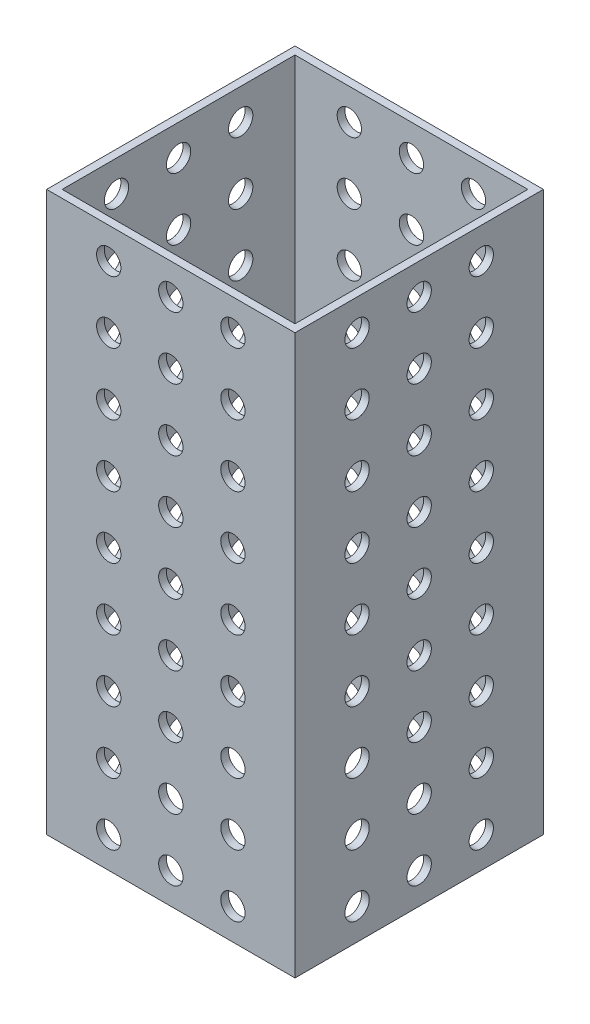
from build123d import *

# Parameters (mm, degrees)
SKETCH1_W           = 50.8
SKETCH1_H           = 50.8
SKETCH1_W_2         = 47.625
SKETCH1_H_2         = 47.625
BOSS_EXTRUDE1_DEPTH = 685.8
SKETCH2_R           = 2.4892
CUT_EXTRUDE1_DEPTH  = 689.147832955
SKETCH4_R           = 2.4892
CUT_EXTRUDE2_DEPTH  = 689.147832955
SKETCH5_W           = 50.8
SKETCH5_H           = 571.5
CUT_EXTRUDE3_DEPTH  = 689.147832955


with BuildPart() as part:
    # Sketch1 → Boss-Extrude1 (new body)
    with BuildSketch(Plane(origin=(0, 0, 0), x_dir=(1, 0, 0), z_dir=(0, 1, 0))):
        Rectangle(SKETCH1_W, SKETCH1_H)
        Rectangle(SKETCH1_W_2, SKETCH1_H_2, mode=Mode.SUBTRACT)
    extrude(amount=BOSS_EXTRUDE1_DEPTH)

    # Sketch2 → Cut-Extrude1 (cut, through all)
    with BuildSketch(Plane.XY.offset(25.4)):
        with Locations((-12.7, 679.45)):
            Circle(SKETCH2_R)
        with Locations((-12.7, 666.75)):
            Circle(SKETCH2_R)
        with Locations((-12.7, 654.05)):
            Circle(SKETCH2_R)
        with Locations((-12.7, 641.35)):
            Circle(SKETCH2_R)
        with Locations((-12.7, 628.65)):
            Circle(SKETCH2_R)
        with Locations((-12.7, 615.95)):
            Circle(SKETCH2_R)
        with Locations((-12.7, 603.25)):
            Circle(SKETCH2_R)
        with Locations((-12.7, 590.55)):
            Circle(SKETCH2_R)
        with Locations((-12.7, 577.85)):
            Circle(SKETCH2_R)
        with Locations((-12.7, 565.15)):
            Circle(SKETCH2_R)
        with Locations((-12.7, 552.45)):
            Circle(SKETCH2_R)
        with Locations((-12.7, 539.75)):
            Circle(SKETCH2_R)
        with Locations((-12.7, 527.05)):
            Circle(SKETCH2_R)
        with Locations((-12.7, 514.35)):
            Circle(SKETCH2_R)
        with Locations((-12.7, 501.65)):
            Circle(SKETCH2_R)
        with Locations((-12.7, 488.95)):
            Circle(SKETCH2_R)
        with Locations((-12.7, 476.25)):
            Circle(SKETCH2_R)
        with Locations((-12.7, 463.55)):
            Circle(SKETCH2_R)
        with Locations((-12.7, 450.85)):
            Circle(SKETCH2_R)
        with Locations((-12.7, 438.15)):
            Circle(SKETCH2_R)
        with Locations((-12.7, 425.45)):
            Circle(SKETCH2_R)
        with Locations((-12.7, 412.75)):
            Circle(SKETCH2_R)
        with Locations((-12.7, 400.05)):
            Circle(SKETCH2_R)
        with Locations((-12.7, 387.35)):
            Circle(SKETCH2_R)
        with Locations((-12.7, 374.65)):
            Circle(SKETCH2_R)
        with Locations((-12.7, 361.95)):
            Circle(SKETCH2_R)
        with Locations((-12.7, 349.25)):
            Circle(SKETCH2_R)
        with Locations((-12.7, 336.55)):
            Circle(SKETCH2_R)
        with Locations((-12.7, 323.85)):
            Circle(SKETCH2_R)
        with Locations((-12.7, 311.15)):
            Circle(SKETCH2_R)
        with Locations((-12.7, 298.45)):
            Circle(SKETCH2_R)
        with Locations((-12.7, 285.75)):
            Circle(SKETCH2_R)
        with Locations((-12.7, 273.05)):
            Circle(SKETCH2_R)
        with Locations((-12.7, 260.35)):
            Circle(SKETCH2_R)
        with Locations((-12.7, 247.65)):
            Circle(SKETCH2_R)
        with Locations((-12.7, 234.95)):
            Circle(SKETCH2_R)
        with Locations((-12.7, 222.25)):
            Circle(SKETCH2_R)
        with Locations((-12.7, 209.55)):
            Circle(SKETCH2_R)
        with Locations((-12.7, 196.85)):
            Circle(SKETCH2_R)
        with Locations((-12.7, 184.15)):
            Circle(SKETCH2_R)
        with Locations((-12.7, 171.45)):
            Circle(SKETCH2_R)
        with Locations((-12.7, 158.75)):
            Circle(SKETCH2_R)
        with Locations((-12.7, 146.05)):
            Circle(SKETCH2_R)
        with Locations((-12.7, 133.35)):
            Circle(SKETCH2_R)
        with Locations((-12.7, 120.65)):
            Circle(SKETCH2_R)
        with Locations((-12.7, 107.95)):
            Circle(SKETCH2_R)
        with Locations((-12.7, 95.25)):
            Circle(SKETCH2_R)
        with Locations((-12.7, 82.55)):
            Circle(SKETCH2_R)
        with Locations((-12.7, 69.85)):
            Circle(SKETCH2_R)
        with Locations((-12.7, 57.15)):
            Circle(SKETCH2_R)
        with Locations((-12.7, 44.45)):
            Circle(SKETCH2_R)
        with Locations((-12.7, 31.75)):
            Circle(SKETCH2_R)
        with Locations((-12.7, 19.05)):
            Circle(SKETCH2_R)
        with Locations((-12.7, 6.35)):
            Circle(SKETCH2_R)
        with Locations((12.7, 6.35)):
            Circle(SKETCH2_R)
        with Locations((12.7, 19.05)):
            Circle(SKETCH2_R)
        with Locations((12.7, 31.75)):
            Circle(SKETCH2_R)
        with Locations((12.7, 44.45)):
            Circle(SKETCH2_R)
        with Locations((12.7, 57.15)):
            Circle(SKETCH2_R)
        with Locations((12.7, 69.85)):
            Circle(SKETCH2_R)
        with Locations((12.7, 82.55)):
            Circle(SKETCH2_R)
        with Locations((12.7, 95.25)):
            Circle(SKETCH2_R)
        with Locations((12.7, 107.95)):
            Circle(SKETCH2_R)
        with Locations((12.7, 120.65)):
            Circle(SKETCH2_R)
        with Locations((12.7, 133.35)):
            Circle(SKETCH2_R)
        with Locations((12.7, 146.05)):
            Circle(SKETCH2_R)
        with Locations((12.7, 158.75)):
            Circle(SKETCH2_R)
        with Locations((12.7, 171.45)):
            Circle(SKETCH2_R)
        with Locations((12.7, 184.15)):
            Circle(SKETCH2_R)
        with Locations((12.7, 196.85)):
            Circle(SKETCH2_R)
        with Locations((12.7, 209.55)):
            Circle(SKETCH2_R)
        with Locations((12.7, 222.25)):
            Circle(SKETCH2_R)
        with Locations((12.7, 234.95)):
            Circle(SKETCH2_R)
        with Locations((12.7, 247.65)):
            Circle(SKETCH2_R)
        with Locations((12.7, 260.35)):
            Circle(SKETCH2_R)
        with Locations((12.7, 273.05)):
            Circle(SKETCH2_R)
        with Locations((12.7, 285.75)):
            Circle(SKETCH2_R)
        with Locations((12.7, 298.45)):
            Circle(SKETCH2_R)
        with Locations((12.7, 311.15)):
            Circle(SKETCH2_R)
        with Locations((12.7, 323.85)):
            Circle(SKETCH2_R)
        with Locations((12.7, 336.55)):
            Circle(SKETCH2_R)
        with Locations((12.7, 374.65)):
            Circle(SKETCH2_R)
        with Locations((12.7, 361.95)):
            Circle(SKETCH2_R)
        with Locations((12.7, 349.25)):
            Circle(SKETCH2_R)
        with Locations((12.7, 387.35)):
            Circle(SKETCH2_R)
        with Locations((12.7, 400.05)):
            Circle(SKETCH2_R)
        with Locations((12.7, 412.75)):
            Circle(SKETCH2_R)
        with Locations((12.7, 425.45)):
            Circle(SKETCH2_R)
        with Locations((12.7, 438.15)):
            Circle(SKETCH2_R)
        with Locations((12.7, 450.85)):
            Circle(SKETCH2_R)
        with Locations((12.7, 463.55)):
            Circle(SKETCH2_R)
        with Locations((12.7, 476.25)):
            Circle(SKETCH2_R)
        with Locations((12.7, 488.95)):
            Circle(SKETCH2_R)
        with Locations((12.7, 501.65)):
            Circle(SKETCH2_R)
        with Locations((12.7, 514.35)):
            Circle(SKETCH2_R)
        with Locations((12.7, 527.05)):
            Circle(SKETCH2_R)
        with Locations((12.7, 539.75)):
            Circle(SKETCH2_R)
        with Locations((12.7, 552.45)):
            Circle(SKETCH2_R)
        with Locations((12.7, 565.15)):
            Circle(SKETCH2_R)
        with Locations((12.7, 577.85)):
            Circle(SKETCH2_R)
        with Locations((12.7, 590.55)):
            Circle(SKETCH2_R)
        with Locations((12.7, 603.25)):
            Circle(SKETCH2_R)
        with Locations((12.7, 615.95)):
            Circle(SKETCH2_R)
        with Locations((12.7, 628.65)):
            Circle(SKETCH2_R)
        with Locations((12.7, 641.35)):
            Circle(SKETCH2_R)
        with Locations((12.7, 654.05)):
            Circle(SKETCH2_R)
        with Locations((12.7, 666.75)):
            Circle(SKETCH2_R)
        with Locations((12.7, 679.45)):
            Circle(SKETCH2_R)
        with Locations((0, 6.35)):
            Circle(SKETCH2_R)
        with Locations((0, 19.05)):
            Circle(SKETCH2_R)
        with Locations((0, 31.75)):
            Circle(SKETCH2_R)
        with Locations((0, 44.45)):
            Circle(SKETCH2_R)
        with Locations((0, 57.15)):
            Circle(SKETCH2_R)
        with Locations((0, 69.85)):
            Circle(SKETCH2_R)
        with Locations((0, 82.55)):
            Circle(SKETCH2_R)
        with Locations((0, 95.25)):
            Circle(SKETCH2_R)
        with Locations((0, 107.95)):
            Circle(SKETCH2_R)
        with Locations((0, 120.65)):
            Circle(SKETCH2_R)
        with Locations((0, 133.35)):
            Circle(SKETCH2_R)
        with Locations((0, 146.05)):
            Circle(SKETCH2_R)
        with Locations((0, 158.75)):
            Circle(SKETCH2_R)
        with Locations((0, 171.45)):
            Circle(SKETCH2_R)
        with Locations((0, 184.15)):
            Circle(SKETCH2_R)
        with Locations((0, 196.85)):
            Circle(SKETCH2_R)
        with Locations((0, 209.55)):
            Circle(SKETCH2_R)
        with Locations((0, 222.25)):
            Circle(SKETCH2_R)
        with Locations((0, 234.95)):
            Circle(SKETCH2_R)
        with Locations((0, 247.65)):
            Circle(SKETCH2_R)
        with Locations((0, 260.35)):
            Circle(SKETCH2_R)
        with Locations((0, 273.05)):
            Circle(SKETCH2_R)
        with Locations((0, 285.75)):
            Circle(SKETCH2_R)
        with Locations((0, 298.45)):
            Circle(SKETCH2_R)
        with Locations((0, 311.15)):
            Circle(SKETCH2_R)
        with Locations((0, 323.85)):
            Circle(SKETCH2_R)
        with Locations((0, 336.55)):
            Circle(SKETCH2_R)
        with Locations((0, 349.25)):
            Circle(SKETCH2_R)
        with Locations((0, 361.95)):
            Circle(SKETCH2_R)
        with Locations((0, 374.65)):
            Circle(SKETCH2_R)
        with Locations((0, 387.35)):
            Circle(SKETCH2_R)
        with Locations((0, 400.05)):
            Circle(SKETCH2_R)
        with Locations((0, 412.75)):
            Circle(SKETCH2_R)
        with Locations((0, 425.45)):
            Circle(SKETCH2_R)
        with Locations((0, 438.15)):
            Circle(SKETCH2_R)
        with Locations((0, 450.85)):
            Circle(SKETCH2_R)
        with Locations((0, 463.55)):
            Circle(SKETCH2_R)
        with Locations((0, 476.25)):
            Circle(SKETCH2_R)
        with Locations((0, 488.95)):
            Circle(SKETCH2_R)
        with Locations((0, 501.65)):
            Circle(SKETCH2_R)
        with Locations((0, 514.35)):
            Circle(SKETCH2_R)
        with Locations((0, 527.05)):
            Circle(SKETCH2_R)
        with Locations((0, 539.75)):
            Circle(SKETCH2_R)
        with Locations((0, 552.45)):
            Circle(SKETCH2_R)
        with Locations((0, 565.15)):
            Circle(SKETCH2_R)
        with Locations((0, 577.85)):
            Circle(SKETCH2_R)
        with Locations((0, 590.55)):
            Circle(SKETCH2_R)
        with Locations((0, 603.25)):
            Circle(SKETCH2_R)
        with Locations((0, 615.95)):
            Circle(SKETCH2_R)
        with Locations((0, 628.65)):
            Circle(SKETCH2_R)
        with Locations((0, 641.35)):
            Circle(SKETCH2_R)
        with Locations((0, 654.05)):
            Circle(SKETCH2_R)
        with Locations((0, 666.75)):
            Circle(SKETCH2_R)
        with Locations((0, 679.45)):
            Circle(SKETCH2_R)
    extrude(amount=-CUT_EXTRUDE1_DEPTH, mode=Mode.SUBTRACT)

    # Sketch4 → Cut-Extrude2 (cut, through all)
    with BuildSketch(Plane(origin=(25.4, 0, 0), x_dir=(0, 0, -1), z_dir=(1, 0, 0))):
        with Locations((-12.7, 679.45)):
            Circle(SKETCH4_R)
        with Locations((-12.7, 666.75)):
            Circle(SKETCH4_R)
        with Locations((-12.7, 654.05)):
            Circle(SKETCH4_R)
        with Locations((-12.7, 641.35)):
            Circle(SKETCH4_R)
        with Locations((-12.7, 628.65)):
            Circle(SKETCH4_R)
        with Locations((-12.7, 615.95)):
            Circle(SKETCH4_R)
        with Locations((-12.7, 603.25)):
            Circle(SKETCH4_R)
        with Locations((-12.7, 590.55)):
            Circle(SKETCH4_R)
        with Locations((-12.7, 577.85)):
            Circle(SKETCH4_R)
        with Locations((-12.7, 565.15)):
            Circle(SKETCH4_R)
        with Locations((-12.7, 552.45)):
            Circle(SKETCH4_R)
        with Locations((-12.7, 539.75)):
            Circle(SKETCH4_R)
        with Locations((-12.7, 527.05)):
            Circle(SKETCH4_R)
        with Locations((-12.7, 514.35)):
            Circle(SKETCH4_R)
        with Locations((-12.7, 501.65)):
            Circle(SKETCH4_R)
        with Locations((-12.7, 488.95)):
            Circle(SKETCH4_R)
        with Locations((-12.7, 476.25)):
            Circle(SKETCH4_R)
        with Locations((-12.7, 463.55)):
            Circle(SKETCH4_R)
        with Locations((-12.7, 450.85)):
            Circle(SKETCH4_R)
        with Locations((-12.7, 438.15)):
            Circle(SKETCH4_R)
        with Locations((-12.7, 425.45)):
            Circle(SKETCH4_R)
        with Locations((-12.7, 412.75)):
            Circle(SKETCH4_R)
        with Locations((-12.7, 400.05)):
            Circle(SKETCH4_R)
        with Locations((-12.7, 387.35)):
            Circle(SKETCH4_R)
        with Locations((-12.7, 374.65)):
            Circle(SKETCH4_R)
        with Locations((-12.7, 361.95)):
            Circle(SKETCH4_R)
        with Locations((-12.7, 349.25)):
            Circle(SKETCH4_R)
        with Locations((-12.7, 336.55)):
            Circle(SKETCH4_R)
        with Locations((-12.7, 323.85)):
            Circle(SKETCH4_R)
        with Locations((-12.7, 311.15)):
            Circle(SKETCH4_R)
        with Locations((-12.7, 298.45)):
            Circle(SKETCH4_R)
        with Locations((-12.7, 285.75)):
            Circle(SKETCH4_R)
        with Locations((-12.7, 273.05)):
            Circle(SKETCH4_R)
        with Locations((-12.7, 260.35)):
            Circle(SKETCH4_R)
        with Locations((-12.7, 247.65)):
            Circle(SKETCH4_R)
        with Locations((-12.7, 234.95)):
            Circle(SKETCH4_R)
        with Locations((-12.7, 222.25)):
            Circle(SKETCH4_R)
        with Locations((-12.7, 209.55)):
            Circle(SKETCH4_R)
        with Locations((-12.7, 196.85)):
            Circle(SKETCH4_R)
        with Locations((-12.7, 184.15)):
            Circle(SKETCH4_R)
        with Locations((-12.7, 171.45)):
            Circle(SKETCH4_R)
        with Locations((-12.7, 158.75)):
            Circle(SKETCH4_R)
        with Locations((-12.7, 146.05)):
            Circle(SKETCH4_R)
        with Locations((-12.7, 133.35)):
            Circle(SKETCH4_R)
        with Locations((-12.7, 120.65)):
            Circle(SKETCH4_R)
        with Locations((-12.7, 107.95)):
            Circle(SKETCH4_R)
        with Locations((-12.7, 95.25)):
            Circle(SKETCH4_R)
        with Locations((-12.7, 82.55)):
            Circle(SKETCH4_R)
        with Locations((-12.7, 69.85)):
            Circle(SKETCH4_R)
        with Locations((-12.7, 57.15)):
            Circle(SKETCH4_R)
        with Locations((-12.7, 44.45)):
            Circle(SKETCH4_R)
        with Locations((-12.7, 31.75)):
            Circle(SKETCH4_R)
        with Locations((-12.7, 19.05)):
            Circle(SKETCH4_R)
        with Locations((-12.7, 6.35)):
            Circle(SKETCH4_R)
        with Locations((12.7, 273.05)):
            Circle(SKETCH4_R)
        with Locations((12.7, 285.75)):
            Circle(SKETCH4_R)
        with Locations((12.7, 298.45)):
            Circle(SKETCH4_R)
        with Locations((12.7, 311.15)):
            Circle(SKETCH4_R)
        with Locations((12.7, 323.85)):
            Circle(SKETCH4_R)
        with Locations((12.7, 336.55)):
            Circle(SKETCH4_R)
        with Locations((12.7, 349.25)):
            Circle(SKETCH4_R)
        with Locations((12.7, 361.95)):
            Circle(SKETCH4_R)
        with Locations((12.7, 374.65)):
            Circle(SKETCH4_R)
        with Locations((12.7, 387.35)):
            Circle(SKETCH4_R)
        with Locations((12.7, 400.05)):
            Circle(SKETCH4_R)
        with Locations((12.7, 412.75)):
            Circle(SKETCH4_R)
        with Locations((12.7, 425.45)):
            Circle(SKETCH4_R)
        with Locations((12.7, 438.15)):
            Circle(SKETCH4_R)
        with Locations((12.7, 450.85)):
            Circle(SKETCH4_R)
        with Locations((12.7, 463.55)):
            Circle(SKETCH4_R)
        with Locations((12.7, 476.25)):
            Circle(SKETCH4_R)
        with Locations((12.7, 488.95)):
            Circle(SKETCH4_R)
        with Locations((12.7, 501.65)):
            Circle(SKETCH4_R)
        with Locations((12.7, 514.35)):
            Circle(SKETCH4_R)
        with Locations((12.7, 527.05)):
            Circle(SKETCH4_R)
        with Locations((12.7, 539.75)):
            Circle(SKETCH4_R)
        with Locations((12.7, 552.45)):
            Circle(SKETCH4_R)
        with Locations((12.7, 565.15)):
            Circle(SKETCH4_R)
        with Locations((12.7, 577.85)):
            Circle(SKETCH4_R)
        with Locations((12.7, 590.55)):
            Circle(SKETCH4_R)
        with Locations((12.7, 603.25)):
            Circle(SKETCH4_R)
        with Locations((12.7, 615.95)):
            Circle(SKETCH4_R)
        with Locations((12.7, 628.65)):
            Circle(SKETCH4_R)
        with Locations((12.7, 641.35)):
            Circle(SKETCH4_R)
        with Locations((12.7, 654.05)):
            Circle(SKETCH4_R)
        with Locations((12.7, 666.75)):
            Circle(SKETCH4_R)
        with Locations((12.7, 19.05)):
            Circle(SKETCH4_R)
        with Locations((12.7, 31.75)):
            Circle(SKETCH4_R)
        with Locations((12.7, 44.45)):
            Circle(SKETCH4_R)
        with Locations((12.7, 57.15)):
            Circle(SKETCH4_R)
        with Locations((12.7, 69.85)):
            Circle(SKETCH4_R)
        with Locations((12.7, 82.55)):
            Circle(SKETCH4_R)
        with Locations((12.7, 95.25)):
            Circle(SKETCH4_R)
        with Locations((12.7, 107.95)):
            Circle(SKETCH4_R)
        with Locations((12.7, 120.65)):
            Circle(SKETCH4_R)
        with Locations((12.7, 133.35)):
            Circle(SKETCH4_R)
        with Locations((12.7, 146.05)):
            Circle(SKETCH4_R)
        with Locations((12.7, 158.75)):
            Circle(SKETCH4_R)
        with Locations((12.7, 171.45)):
            Circle(SKETCH4_R)
        with Locations((12.7, 184.15)):
            Circle(SKETCH4_R)
        with Locations((12.7, 196.85)):
            Circle(SKETCH4_R)
        with Locations((12.7, 209.55)):
            Circle(SKETCH4_R)
        with Locations((12.7, 222.25)):
            Circle(SKETCH4_R)
        with Locations((12.7, 234.95)):
            Circle(SKETCH4_R)
        with Locations((12.7, 247.65)):
            Circle(SKETCH4_R)
        with Locations((12.7, 260.35)):
            Circle(SKETCH4_R)
        with Locations((12.7, 6.35)):
            Circle(SKETCH4_R)
        with Locations((12.7, 679.45)):
            Circle(SKETCH4_R)
        with Locations((0, 6.35)):
            Circle(SKETCH4_R)
        with Locations((0, 19.05)):
            Circle(SKETCH4_R)
        with Locations((0, 31.75)):
            Circle(SKETCH4_R)
        with Locations((0, 44.45)):
            Circle(SKETCH4_R)
        with Locations((0, 57.15)):
            Circle(SKETCH4_R)
        with Locations((0, 69.85)):
            Circle(SKETCH4_R)
        with Locations((0, 82.55)):
            Circle(SKETCH4_R)
        with Locations((0, 95.25)):
            Circle(SKETCH4_R)
        with Locations((0, 107.95)):
            Circle(SKETCH4_R)
        with Locations((0, 120.65)):
            Circle(SKETCH4_R)
        with Locations((0, 133.35)):
            Circle(SKETCH4_R)
        with Locations((0, 146.05)):
            Circle(SKETCH4_R)
        with Locations((0, 158.75)):
            Circle(SKETCH4_R)
        with Locations((0, 171.45)):
            Circle(SKETCH4_R)
        with Locations((0, 184.15)):
            Circle(SKETCH4_R)
        with Locations((0, 196.85)):
            Circle(SKETCH4_R)
        with Locations((0, 209.55)):
            Circle(SKETCH4_R)
        with Locations((0, 222.25)):
            Circle(SKETCH4_R)
        with Locations((0, 234.95)):
            Circle(SKETCH4_R)
        with Locations((0, 247.65)):
            Circle(SKETCH4_R)
        with Locations((0, 260.35)):
            Circle(SKETCH4_R)
        with Locations((0, 273.05)):
            Circle(SKETCH4_R)
        with Locations((0, 285.75)):
            Circle(SKETCH4_R)
        with Locations((0, 298.45)):
            Circle(SKETCH4_R)
        with Locations((0, 311.15)):
            Circle(SKETCH4_R)
        with Locations((0, 323.85)):
            Circle(SKETCH4_R)
        with Locations((0, 336.55)):
            Circle(SKETCH4_R)
        with Locations((0, 349.25)):
            Circle(SKETCH4_R)
        with Locations((0, 361.95)):
            Circle(SKETCH4_R)
        with Locations((0, 374.65)):
            Circle(SKETCH4_R)
        with Locations((0, 387.35)):
            Circle(SKETCH4_R)
        with Locations((0, 400.05)):
            Circle(SKETCH4_R)
        with Locations((0, 412.75)):
            Circle(SKETCH4_R)
        with Locations((0, 425.45)):
            Circle(SKETCH4_R)
        with Locations((0, 438.15)):
            Circle(SKETCH4_R)
        with Locations((0, 450.85)):
            Circle(SKETCH4_R)
        with Locations((0, 463.55)):
            Circle(SKETCH4_R)
        with Locations((0, 476.25)):
            Circle(SKETCH4_R)
        with Locations((0, 488.95)):
            Circle(SKETCH4_R)
        with Locations((0, 501.65)):
            Circle(SKETCH4_R)
        with Locations((0, 514.35)):
            Circle(SKETCH4_R)
        with Locations((0, 527.05)):
            Circle(SKETCH4_R)
        with Locations((0, 539.75)):
            Circle(SKETCH4_R)
        with Locations((0, 552.45)):
            Circle(SKETCH4_R)
        with Locations((0, 565.15)):
            Circle(SKETCH4_R)
        with Locations((0, 577.85)):
            Circle(SKETCH4_R)
        with Locations((0, 590.55)):
            Circle(SKETCH4_R)
        with Locations((0, 603.25)):
            Circle(SKETCH4_R)
        with Locations((0, 615.95)):
            Circle(SKETCH4_R)
        with Locations((0, 628.65)):
            Circle(SKETCH4_R)
        with Locations((0, 641.35)):
            Circle(SKETCH4_R)
        with Locations((0, 654.05)):
            Circle(SKETCH4_R)
        with Locations((0, 666.75)):
            Circle(SKETCH4_R)
        with Locations((0, 679.45)):
            Circle(SKETCH4_R)
    extrude(amount=-CUT_EXTRUDE2_DEPTH, mode=Mode.SUBTRACT)

    # Sketch5 → Cut-Extrude3 (cut, through all)
    with BuildSketch(Plane(origin=(25.4, 0, 0), x_dir=(0, 0, -1), z_dir=(1, 0, 0))):
        with Locations((0, 400.05)):
            Rectangle(SKETCH5_W, SKETCH5_H)
    extrude(amount=-CUT_EXTRUDE3_DEPTH, mode=Mode.SUBTRACT)


solid = part.part
